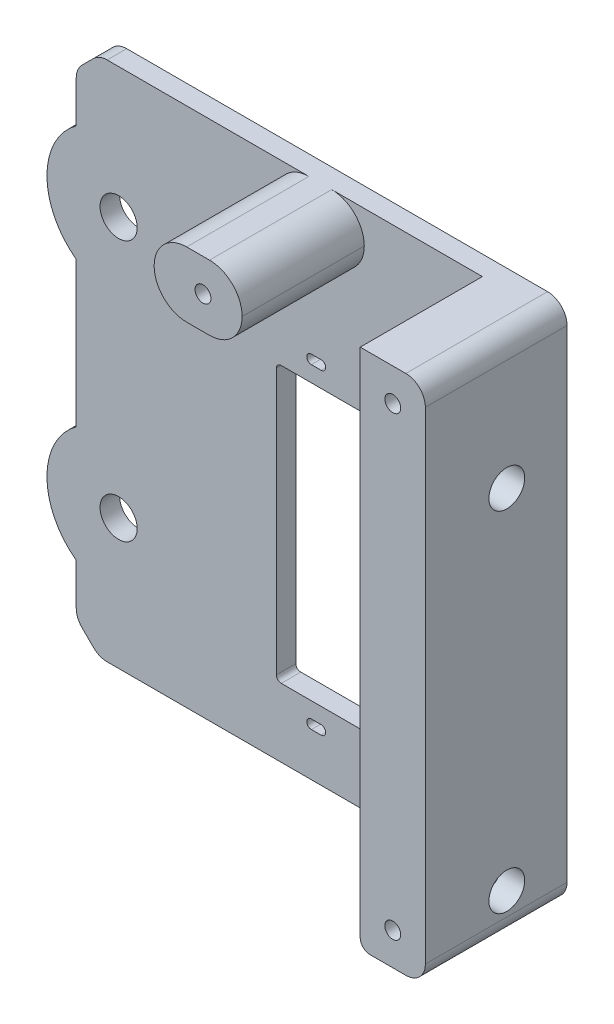
from build123d import *

# Parameters (mm, degrees)
BASE_W                 = 22.25
BASE_H                 = 42.25
MAIN_DEPTH             = 3
GEAR_AXIS_HOLES_D      = 5.7
M1_6_CLEARANCE_HOLE1_D = 1.4
BOSS_EXTRUDE1_DEPTH    = 18.75
FILLET2_R              = 0.75
FILLET4_R              = 5
FILLET8_R              = 1.5
BOSS_EXTRUDE2_DEPTH    = 3
CHAMFER1_SIZE          = 3.5
FILLET6_R              = 3
CUT_EXTRUDE1_DEPTH     = 62.805259158
F_2_CLEARANCE_HOLE1_D  = 2.4384
M5_CLEARANCE_HOLE1_D   = 5.5
SKETCH20_W             = 18.125
SKETCH20_H             = 15
CUT_EXTRUDE2_DEPTH     = 18.75
FILLET7_R              = 5


with BuildPart() as part:
    # Base → Main (new body)
    with BuildSketch(Plane.XY):
        Polygon((-29.105845183, 40), (-29.105845183, -40), (-17.775845183, -40), (43.224154817, -40), (43.224154817, 40), align=None)
        with Locations((12.724154817, -8.375)):
            Rectangle(BASE_W, BASE_H, mode=Mode.SUBTRACT)
    extrude(amount=MAIN_DEPTH)

    # Gear Axis Holes (through all)
    with Locations(Plane(origin=(0, 0, 3), x_dir=(-1, 0, 0), z_dir=(0, 0, 1))):
        with Locations((22.605845183, 20), (22.605845183, -20)):
            Hole(GEAR_AXIS_HOLES_D / 2)

    # M1.6 Clearance Hole1 (through all)
    with Locations(Plane.XY.offset(3)):
        with Locations((17.724154817, -32.625), (7.724154817, -32.625), (7.724154817, 15.875), (17.724154817, 15.875)):
            Hole(M1_6_CLEARANCE_HOLE1_D / 2)

    # Sketch13 → Boss-Extrude1 (add)
    with BuildSketch(Plane.XY.offset(3)):
        Polygon((1.599154817, 30), (33.224154817, 30), (33.224154817, 1), (33.224154817, -30), (33.224154817, -40), (43.224154817, -40), (43.224154817, 1), (43.224154817, 40), (1.599154817, 40), align=None)
    extrude(amount=BOSS_EXTRUDE1_DEPTH)

    # Fillet2
    fillet2_edges = [part.edges().sort_by_distance(p)[0] for p in [
        (1.599154817, -29.5, 1.5),
        (23.849154817, -29.5, 1.5),
        (23.849154817, 12.75, 1.5),
        (1.599154817, 12.75, 1.5),
    ]]
    fillet(fillet2_edges, radius=FILLET2_R)

    # Fillet4
    fillet4_edges = [part.edges().sort_by_distance(p)[0] for p in [
        (1.599154817, 40, 12.375),
        (1.599154817, 30, 12.375),
        (33.224154817, 30, 12.375),
    ]]
    fillet(fillet4_edges, radius=FILLET4_R - 0.0001)  # a hair under: the kernel refuses the full size

    # Fillet8
    fillet8_edges = [part.edges().sort_by_distance(p)[0] for p in [
        (33.224154817, -40, 12.375),
    ]]
    fillet(fillet8_edges, radius=FILLET8_R)

    # Sketch21 → Boss-Extrude2 (add)
    with BuildSketch(Plane.XY.offset(3)):
        with BuildLine():
            Line((-29.105845183, 28.874119675), (-29.105845183, 11.125880325))
            ThreePointArc((-29.105845183, 11.125880325), (-33.605845183, 20), (-29.105845183, 28.874119675))
        make_face()
        with BuildLine():
            Line((-29.105845183, -11.125880325), (-29.105845183, -28.874119675))
            ThreePointArc((-29.105845183, -28.874119675), (-33.605845183, -20), (-29.105845183, -11.125880325))
        make_face()
    extrude(amount=-BOSS_EXTRUDE2_DEPTH)

    # Chamfer1
    chamfer1_edges = [part.edges().sort_by_distance(p)[0] for p in [
        (-29.105845183, -40, 1.5),
        (-29.105845183, 40, 1.5),
    ]]
    chamfer(chamfer1_edges, length=CHAMFER1_SIZE)

    # Fillet6
    fillet6_edges = [part.edges().sort_by_distance(p)[0] for p in [
        (-25.605845183, -40, 1.5),
        (-29.105845183, -36.5, 1.5),
        (-29.105845183, 36.5, 1.5),
        (-25.605845183, 40, 1.5),
        (43.224154817, 40, 10.875),
        (43.224154817, -40, 10.875),
    ]]
    fillet(fillet6_edges, radius=FILLET6_R)

    # Sketch14 → Cut-Extrude1 (cut, through all)
    with BuildSketch(Plane.XY.offset(3)):
        with BuildLine():
            Line((8.474154817, -33.325), (6.974154817, -33.325))
            ThreePointArc((6.974154817, -33.325), (6.274154817, -32.625), (6.974154817, -31.925))
            Line((6.974154817, -31.925), (8.474154817, -31.925))
            ThreePointArc((8.474154817, -31.925), (9.174154817, -32.625), (8.474154817, -33.325))
        make_face()
        with BuildLine():
            Line((18.474154817, -33.325), (16.974154817, -33.325))
            ThreePointArc((16.974154817, -33.325), (16.274154817, -32.625), (16.974154817, -31.925))
            Line((16.974154817, -31.925), (18.474154817, -31.925))
            ThreePointArc((18.474154817, -31.925), (19.174154817, -32.625), (18.474154817, -33.325))
        make_face()
        with BuildLine():
            Line((8.474154817, 16.575), (6.974154817, 16.575))
            ThreePointArc((6.974154817, 16.575), (6.274154817, 15.875), (6.974154817, 15.175))
            Line((6.974154817, 15.175), (8.474154817, 15.175))
            ThreePointArc((8.474154817, 15.175), (9.174154817, 15.875), (8.474154817, 16.575))
        make_face()
        with BuildLine():
            Line((18.474154817, 16.575), (16.974154817, 16.575))
            ThreePointArc((16.974154817, 16.575), (16.274154817, 15.875), (16.974154817, 15.175))
            Line((16.974154817, 15.175), (18.474154817, 15.175))
            ThreePointArc((18.474154817, 15.175), (19.174154817, 15.875), (18.474154817, 16.575))
        make_face()
    extrude(amount=-CUT_EXTRUDE1_DEPTH, mode=Mode.SUBTRACT)

    # #2 Clearance Hole1 (through all)
    with Locations(Plane.XY.offset(21.75)):
        with Locations((9.099154817, 35), (38.224154817, 35), (38.224154817, -35)):
            Hole(F_2_CLEARANCE_HOLE1_D / 2)

    # M5 Clearance Hole1 (through all)
    with Locations(Plane.ZY.offset(-33.224154817)):
        with Locations((9.25, 20), (9.25, -33.5)):
            Hole(M5_CLEARANCE_HOLE1_D / 2)

    # Sketch20 → Cut-Extrude2 (cut)
    with BuildSketch(Plane.XY.offset(21.75)):
        with Locations((24.161654817, 32.5)):
            Rectangle(SKETCH20_W, SKETCH20_H)
    extrude(amount=-CUT_EXTRUDE2_DEPTH, mode=Mode.SUBTRACT)

    # Fillet7
    fillet7_edges = [part.edges().sort_by_distance(p)[0] for p in [
        (15.099154817, 40, 12.375),
        (15.099154817, 30, 12.375),
    ]]
    fillet(fillet7_edges, radius=FILLET7_R - 0.0001)  # a hair under: the kernel refuses the full size


solid = part.part
